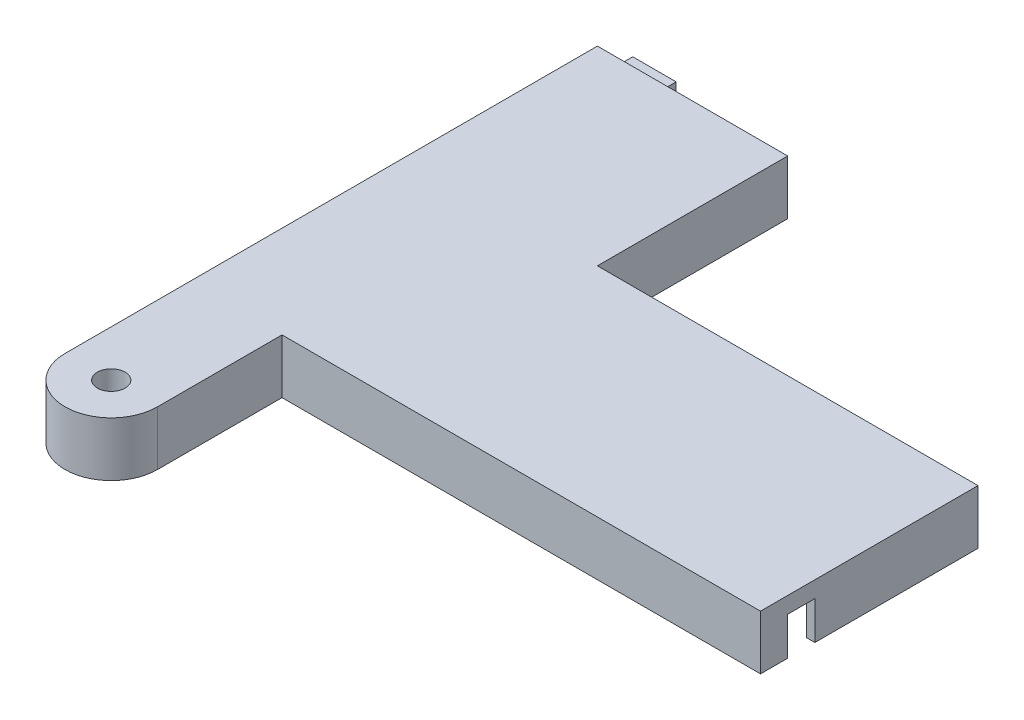
from build123d import *

# Parameters (mm, degrees)
CORNERBOSS_EXTRUDE1_DEPTH               = 20
SHELL4_T                                = -3
PADSKETCH2_R                            = 12
PADBOSS_EXTRUDE2_DEPTH                  = 10
STEPPERSHAFTHOLECUTSKETCH3_R            = 5.1
STEPPERSHAFTHOLECUT_EXTRUDE1_DEPTH      = 288.430740571
THREADEDNUTMOUNTHOLESSKETCH4_R          = 2
THREADEDNUTMOUNTHOLESCUT_EXTRUDE2_DEPTH = 10
BRPEGHOLESKETCH1_W                      = 10
BRPEGHOLESKETCH1_H                      = 14
BRPEGHOLECUT_EXTRUDE1_DEPTH             = 3
TOPPEGSKETCH2_W                         = 9.8
TOPPEGSKETCH2_H                         = 13.9
TOPPEGBOSS_EXTRUDE1_DEPTH               = 3
TOPPEGCAPSKETCH3_W                      = 16
TOPPEGCAPSKETCH3_H                      = 17
TOPPEGCAPBOSS_EXTRUDE2_DEPTH            = 3.1
CENTERPEGHOLECUTSKETCH1_W               = 10
CENTERPEGHOLECUTSKETCH1_H               = 14
CENTERPEGHOLECUT_EXTRUDE1_DEPTH         = 3


with BuildPart() as part:
    # CornerrSketch1 → CornerBoss-Extrude1 (new body)
    with BuildSketch(Plane(origin=(0, 0, 0), x_dir=(1, 0, 0), z_dir=(0, 1, 0))):
        with BuildLine():
            Line((0, 195.825), (70, 195.825))
            Line((70, 195.825), (70, 125.825))
            Line((70, 125.825), (210, 125.825))
            Line((210, 125.825), (210, 45.825))
            Line((210, 45.825), (34, 45.825))
            Line((34, 45.825), (34, 0))
            ThreePointArc((34, 0), (17, -17), (0, 0))
            Line((0, 0), (0, 195.825))
        make_face()
    extrude(amount=CORNERBOSS_EXTRUDE1_DEPTH)

    # Shell4
    shell4_openings = [part.faces().sort_by_distance(p)[0] for p in [
        (83.067785517, 0, -95.408443826),
    ]]
    offset(amount=SHELL4_T, openings=shell4_openings, kind=Kind.INTERSECTION)

    # PadSketch2 → PadBoss-Extrude2 (add)
    with BuildSketch(Plane.XZ.offset(-17)):
        with Locations((17, 0)):
            Circle(PADSKETCH2_R)
    extrude(amount=PADBOSS_EXTRUDE2_DEPTH)

    # StepperShaftHoleCutSketch3 → StepperShaftHoleCut-Extrude1 (cut, through all)
    with BuildSketch(Plane.XZ.offset(-7)):
        with Locations((17, 0)):
            Circle(STEPPERSHAFTHOLECUTSKETCH3_R)
    extrude(amount=-STEPPERSHAFTHOLECUT_EXTRUDE1_DEPTH, mode=Mode.SUBTRACT)

    # ThreadedNutMountHolesSketch4 → ThreadedNutMountHolesCut-Extrude2 (cut)
    with BuildSketch(Plane(origin=(0, 7, 0), x_dir=(-1, 0, 0), z_dir=(0, -1, 0))):
        with Locations((-17, 8)):
            Circle(THREADEDNUTMOUNTHOLESSKETCH4_R)
        with Locations((-17, -8)):
            Circle(THREADEDNUTMOUNTHOLESSKETCH4_R)
        with Locations((-25, 0)):
            Circle(THREADEDNUTMOUNTHOLESSKETCH4_R)
        with Locations((-9, 0)):
            Circle(THREADEDNUTMOUNTHOLESSKETCH4_R)
    extrude(amount=-THREADEDNUTMOUNTHOLESCUT_EXTRUDE2_DEPTH, mode=Mode.SUBTRACT)

    # BRPegHoleSketch1 → BRPegHoleCut-Extrude1 (cut)
    with BuildSketch(Plane(origin=(210, 0, 0), x_dir=(0, 0, -1), z_dir=(1, 0, 0))):
        with Locations((60.825, 7)):
            Rectangle(BRPEGHOLESKETCH1_W, BRPEGHOLESKETCH1_H)
    extrude(amount=-BRPEGHOLECUT_EXTRUDE1_DEPTH, mode=Mode.SUBTRACT)

    # TopPegSketch2 → TopPegBoss-Extrude1 (add)
    with BuildSketch(Plane(origin=(0, 0, -195.825), x_dir=(-1, 0, 0), z_dir=(0, 0, -1))):
        with Locations((-15, 6.95)):
            Rectangle(TOPPEGSKETCH2_W, TOPPEGSKETCH2_H)
    extrude(amount=TOPPEGBOSS_EXTRUDE1_DEPTH)

    # TopPegCapSketch3 → TopPegCapBoss-Extrude2 (add)
    with BuildSketch(Plane(origin=(0, 0, -198.825), x_dir=(-1, 0, 0), z_dir=(0, 0, -1))):
        with Locations((-14.9, 8.5)):
            Rectangle(TOPPEGCAPSKETCH3_W, TOPPEGCAPSKETCH3_H)
    extrude(amount=TOPPEGCAPBOSS_EXTRUDE2_DEPTH)

    # CenterPegHoleCutSketch1 → CenterPegHoleCut-Extrude1 (cut)
    with BuildSketch(Plane(origin=(0, 0, -125.825), x_dir=(-1, 0, 0), z_dir=(0, 0, -1))):
        with Locations((-175, 7)):
            Rectangle(CENTERPEGHOLECUTSKETCH1_W, CENTERPEGHOLECUTSKETCH1_H)
    extrude(amount=-CENTERPEGHOLECUT_EXTRUDE1_DEPTH, mode=Mode.SUBTRACT)


solid = part.part
